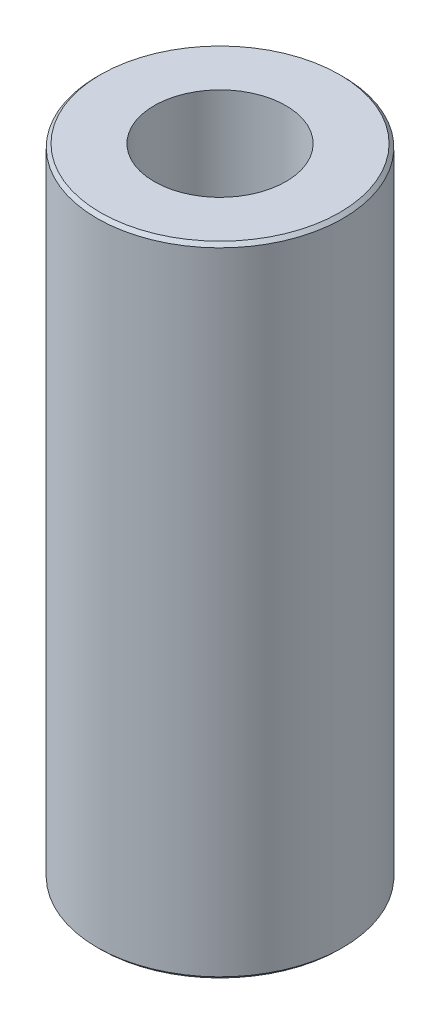
from build123d import *

# Parameters (mm, degrees)
SKETCH1_R           = 60
BOSS_EXTRUDE1_DEPTH = 311.462752225
SKETCH2_R           = 32.148944939
CUT_EXTRUDE1_DEPTH  = 323.814259325
CHAMFER1_SIZE       = 1.649908137


with BuildPart() as part:
    # Sketch1 → Boss-Extrude1 (new body)
    with BuildSketch(Plane(origin=(0, 0, 0), x_dir=(1, 0, 0), z_dir=(0, 1, 0))):
        Circle(SKETCH1_R)
    extrude(amount=BOSS_EXTRUDE1_DEPTH)

    # Sketch2 → Cut-Extrude1 (cut, through all)
    with BuildSketch(Plane(origin=(0, 0, 0), x_dir=(1, 0, 0), z_dir=(0, 1, 0))):
        Circle(SKETCH2_R)
    extrude(amount=CUT_EXTRUDE1_DEPTH, mode=Mode.SUBTRACT)

    # Chamfer1
    chamfer1_edges = [part.edges().sort_by_distance(p)[0] for p in [
        (-60, 311.462752225, 0),
        (-60, 0, 0),
    ]]
    chamfer(chamfer1_edges, length=CHAMFER1_SIZE)


solid = part.part
